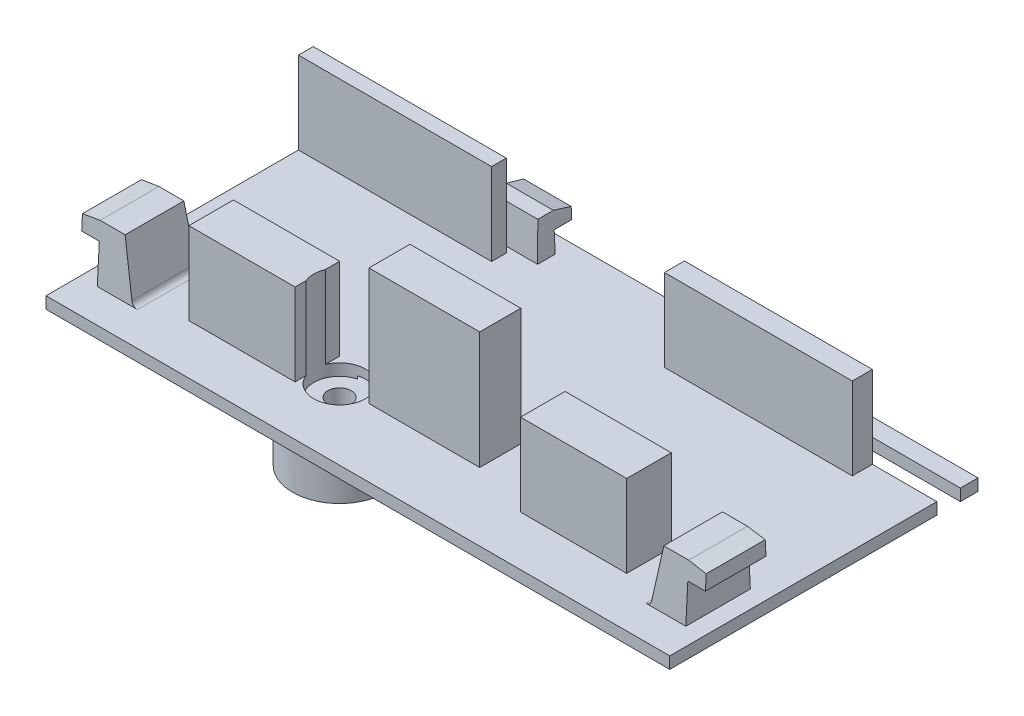
from build123d import *

# Parameters (mm, degrees)
SKETCH1_W                        = 53.116817528
SKETCH1_H                        = 26.25
MAIN_BODY_DEPTH                  = 1
SNAP_START                       = 162.404443258
SNAP_HOOK_RIGHT_DEPTH            = 2.123076923
SNAP_START_2                     = 4.123794828
SNAP_HOOK_RIGHT_2_DEPTH          = 5.157223338
SNAP_START_3                     = 3.953469545
SNAP_HOOK_RIGHT_3_DEPTH          = 5.497873903
SNAP_START_4                     = 160
SNAP_HOOK_RIGHT_4_DEPTH          = 6
SNAP_START_5                     = 210.398183863
SNAP_HOOK_LEFT_DEPTH             = 2.123076923
SNAP_HOOK_LEFT_2_DEPTH           = 5.157223338
SNAP_HOOK_LEFT_3_DEPTH           = 5.497873903
SNAP_START_6                     = 209
SNAP_HOOK_LEFT_4_DEPTH           = 6
SOLAR_ARM_HOLES_REACH            = 216.551
SKETCH6_W                        = 11
SKETCH6_H                        = 2
SKETCH9_W                        = 9.436817528
SKETCH9_H                        = 3.49554206
BOSS_EXTRUDE1_DEPTH              = 10
SKETCH5_W                        = 0.807692308
SKETCH5_H                        = 3.288461538
SKETCH5_H_2                      = 4.615384615
VERSION_2_DEPTH                  = 0.25
FILLET1_R                        = 0.5
SKETCH12_W                       = 16
SKETCH12_H                       = 1.70445794
SERVO_2_SPACER_BOTTOM_BACK_DEPTH = 7
SKETCH13_W                       = 16.45
SKETCH13_H                       = 1.25445794
BOSS_EXTRUDE2_DEPTH              = 7
SKETCH10_W                       = 9.044307921
SKETCH10_H                       = 3.79554206
SERVO_SPACERS_BACK_DEPTH         = 7
SNAP_START_7                     = -12.431072473
SNAP_HOOK3_DEPTH                 = 1.5
SNAP_START_8                     = -13.931072473
SNAP_HOOK3_2_DEPTH               = 1.5
SNAP_START_9                     = 194
SNAP_HOOK3_3_DEPTH               = 7
SNAP_HOOK5_DEPTH                 = 1.5
SNAP_HOOK5_2_DEPTH               = 1.5
SNAP_START_10                    = 174
SNAP_HOOK5_3_DEPTH               = 7
SKETCH14_R                       = 2.2
CUT_EXTRUDE1_DEPTH               = 215.756082322
SKETCH15_R                       = 4
SKETCH15_R_2                     = 1
BOSS_EXTRUDE3_DEPTH              = 5


with BuildPart() as part:
    # Sketch1 → Main Body (new body)
    with BuildSketch(Plane(origin=(0, 0, 0), x_dir=(1, 0, 0), z_dir=(0, 1, 0))):
        with Locations((187.462852022, 0.806072473)):
            Rectangle(SKETCH1_W, SKETCH1_H)
    extrude(amount=MAIN_BODY_DEPTH)



with BuildPart() as body_2:
    # Snap Hook - Right: read off the stored shape, not the designer's step
    # Snap Hook - Right outline → Snap Hook - Right (new body)
    with BuildSketch(Plane.YZ.offset(SNAP_START)):
        Polygon((5.75, 4.202406497), (5.75, 9.202406497), (4.25, 9.281018166), (4.25, 4.123794828), align=None)
    extrude(amount=SNAP_HOOK_RIGHT_DEPTH)


with BuildPart() as part_1:
    add(part.part)

    add(body_2.part)  # Snap Hook - Right 2 merges body 2
    # Snap Hook - Right 2 outline → Snap Hook - Right 2 (add)
    with BuildSketch(Plane.XY.offset(SNAP_START_2)):
        Polygon((164.527520181, 4.25), (162.404443258, 4.25), (162.404443258, 1), (165.404443258, 1), (164.527520181, 5.75), align=None)
        Polygon((160.904443258, 5.5), (160.904443258, 4.25), (162.404443258, 4.25), (162.404443258, 5.75), align=None)
    extrude(amount=SNAP_HOOK_RIGHT_2_DEPTH)

    # Snap Hook - Right 3 outline → Snap Hook - Right 3 (add)
    with BuildSketch(Plane.XY.offset(SNAP_START_3)):
        Polygon((164.527520181, 4.25), (162.404443258, 4.25), (162.404443258, 1), (165.404443258, 1), (164.527520181, 5.75), align=None)
    extrude(amount=SNAP_HOOK_RIGHT_3_DEPTH)

    # Snap Hook - Right 4 outline → Snap Hook - Right 4 (cut)
    with BuildSketch(Plane.YZ.offset(SNAP_START_4)):
        Polygon((5.75, 9.202406497), (7, 9.136896773), (7, 9.451343448), (1, 9.451343448), align=None)
        Polygon((7, 4.267916221), (5.75, 4.202406497), (1, 3.953469545), (7, 3.953469545), align=None)
    extrude(amount=SNAP_HOOK_RIGHT_4_DEPTH, mode=Mode.SUBTRACT)



with BuildPart() as body_2_2:
    # Snap Hook - Left: read off the stored shape, not the designer's step
    # Snap Hook - Left outline → Snap Hook - Left (new body)
    with BuildSketch(Plane.YZ.offset(SNAP_START_5)):
        Polygon((5.75, 4.202406497), (5.75, 9.202406497), (4.25, 9.281018166), (4.25, 4.123794828), align=None)
    extrude(amount=SNAP_HOOK_LEFT_DEPTH)


with BuildPart() as part_2:
    add(part_1.part)

    add(body_2_2.part)  # Snap Hook - Left 2 merges body 2 2
    # Snap Hook - Left 2 outline → Snap Hook - Left 2 (add)
    with BuildSketch(Plane.XY.offset(SNAP_START_2)):
        Polygon((212.521260786, 1), (212.521260786, 4.25), (210.398183863, 4.25), (210.398183863, 5.75), (209.521260786, 1), align=None)
        Polygon((214.021260786, 4.25), (214.021260786, 5.5), (212.521260786, 5.75), (212.521260786, 4.25), align=None)
    extrude(amount=SNAP_HOOK_LEFT_2_DEPTH)

    # Snap Hook - Left 3 outline → Snap Hook - Left 3 (add)
    with BuildSketch(Plane.XY.offset(SNAP_START_3)):
        Polygon((212.521260786, 1), (212.521260786, 4.25), (210.398183863, 4.25), (210.398183863, 5.75), (209.521260786, 1), align=None)
    extrude(amount=SNAP_HOOK_LEFT_3_DEPTH)

    # Snap Hook - Left 4 outline → Snap Hook - Left 4 (cut)
    with BuildSketch(Plane.YZ.offset(SNAP_START_6)):
        Polygon((5.75, 9.202406497), (7, 9.136896773), (7, 9.451343448), (1, 9.451343448), align=None)
        Polygon((7, 4.267916221), (5.75, 4.202406497), (1, 3.953469545), (7, 3.953469545), align=None)
    extrude(amount=SNAP_HOOK_LEFT_4_DEPTH, mode=Mode.SUBTRACT)

    # Sketch6 → Solar Arm holes (cut, up to next)
    with BuildSketch(Plane.XZ, mode=Mode.PRIVATE) as solar_arm_holes_sk1:
        with Locations((166.404443258, -11.431072473)):
            Rectangle(SKETCH6_W, SKETCH6_H)
    solar_arm_holes_tool1 = extrude(solar_arm_holes_sk1.sketch, amount=-SOLAR_ARM_HOLES_REACH, mode=Mode.PRIVATE) & part_2.part
    # Sketch6 → Solar Arm holes (cut, up to next)
    with BuildSketch(Plane.XZ, mode=Mode.PRIVATE) as solar_arm_holes_sk2:
        with Locations((208.521260786, -11.431072473)):
            Rectangle(SKETCH6_W, SKETCH6_H)
    solar_arm_holes_tool2 = extrude(solar_arm_holes_sk2.sketch, amount=-SOLAR_ARM_HOLES_REACH, mode=Mode.PRIVATE) & part_2.part
    add(solar_arm_holes_tool1.solids().sort_by_distance((166.404443, 0, -11.431072))[0], mode=Mode.SUBTRACT)
    add(solar_arm_holes_tool2.solids().sort_by_distance((208.521261, 0, -11.431072))[0], mode=Mode.SUBTRACT)

    # Sketch9 → Boss-Extrude1 (add)
    with BuildSketch(Plane(origin=(0, 1, 0), x_dir=(1, 0, 0), z_dir=(0, 1, 0))):
        with Locations((187.322852022, -4.771156497)):
            Rectangle(SKETCH9_W, SKETCH9_H)
    extrude(amount=BOSS_EXTRUDE1_DEPTH)

    # Sketch5 → Version 2 (cut)
    # profile 1 of 14: a face of its own
    with BuildSketch(Plane.XZ):
        with BuildLine():
            Line((168.666698176, 4.842665507), (168.06273183, 4.290081373))
            add(Edge.make_bspline(
                [(168.06273183, 4.290081373), (168.036860501, 4.326575571), (167.987191158, 4.396639343), (167.906682334, 4.490456385), (167.826537048, 4.570489303), (167.746012804, 4.636403758), (167.664395865, 4.687799269), (167.581827906, 4.724187859), (167.498777028, 4.747320431), (167.442979658, 4.750200992), (167.415496253, 4.751619834)],
                knots=[0, 0, 0, 0, 1.299362458, 2.494594718, 3.587462134, 4.587049575, 5.512617175, 6.380583204, 7.202344345, 8, 8, 8, 8], degree=3))
            add(Edge.make_bspline(
                [(167.415496253, 4.751619834), (167.389860521, 4.750720791), (167.340364658, 4.748984974), (167.269804633, 4.731731089), (167.207160438, 4.701953416), (167.152493211, 4.663016603), (167.109188702, 4.616106771), (167.07461341, 4.566910419), (167.055144615, 4.512608772), (167.052582138, 4.47531221), (167.05131356, 4.4568482)],
                knots=[0, 0, 0, 0, 1.185010067, 2.2879431, 3.333075148, 4.379039566, 5.372662701, 6.27520591, 7.14612461, 8, 8, 8, 8], degree=3))
            add(Edge.make_bspline(
                [(167.05131356, 4.4568482), (167.052108514, 4.43811793), (167.053709439, 4.40039777), (167.069172203, 4.345114177), (167.092479003, 4.291095672), (167.114749602, 4.258212037), (167.126133272, 4.241403488)],
                knots=[0, 0, 0, 0, 0.967525499, 1.948461899, 2.951351359, 4, 4, 4, 4], degree=3))
            add(Edge.make_bspline(
                [(167.126133272, 4.241403488), (167.136482259, 4.228338379), (167.160304262, 4.198264223), (167.205727943, 4.150631447), (167.262770545, 4.092277128), (167.33362719, 4.025207899), (167.415356422, 3.947011689), (167.511746498, 3.860762419), (167.620022889, 3.763789052), (167.69698324, 3.69626031), (167.737311156, 3.660874642)],
                knots=[0, 0, 0, 0, 0.473873513, 1.090794244, 1.870441696, 2.795289791, 3.865433203, 5.087734844, 6.473946851, 8, 8, 8, 8], degree=3))
            add(Edge.make_bspline(
                [(167.737311156, 3.660874642), (167.775164707, 3.628114303), (167.847002882, 3.565941987), (167.949214339, 3.477698365), (168.039041186, 3.398307731), (168.117791996, 3.328961567), (168.184272984, 3.268932274), (168.238763635, 3.217932911), (168.28192946, 3.176956344), (168.306466705, 3.152206472), (168.31693856, 3.141643873)],
                knots=[0, 0, 0, 0, 1.543621617, 2.929473131, 4.163658386, 5.240097082, 6.164993805, 6.925417477, 7.541396219, 8, 8, 8, 8], degree=3))
            add(Edge.make_bspline(
                [(168.31693856, 3.141643873), (168.356666597, 3.098649628), (168.433037837, 3.015999591), (168.532293525, 2.887918026), (168.613984168, 2.762884302), (168.677181597, 2.638545707), (168.724910838, 2.513108283), (168.758560585, 2.383495683), (168.778713643, 2.248353537), (168.780951103, 2.15613552), (168.782082791, 2.10949243)],
                knots=[0, 0, 0, 0, 1.206664779, 2.319633467, 3.337109185, 4.282041471, 5.190008762, 6.099243693, 7.03861361, 8, 8, 8, 8], degree=3))
            add(Edge.make_bspline(
                [(168.782082791, 2.10949243), (168.781277284, 2.06404446), (168.77969685, 1.97487385), (168.760339563, 1.844385946), (168.732737208, 1.719503358), (168.690059125, 1.601584986), (168.63804333, 1.488695236), (168.572834018, 1.38259257), (168.496254623, 1.282203187), (168.408482878, 1.18932167), (168.311396905, 1.105038131), (168.207262973, 1.030006934), (168.095062807, 0.968059123), (167.975755027, 0.91704952), (167.849403497, 0.877761242), (167.716158739, 0.848723542), (167.575816946, 0.831295573), (167.479849205, 0.829473685), (167.430820772, 0.828542911)],
                knots=[0, 0, 0, 0, 1.043214005, 2.046824704, 3.02475056, 3.976699089, 4.921714032, 5.875962561, 6.831408892, 7.817874052, 8.806269674, 9.781291748, 10.760897367, 11.74438705, 12.757449933, 13.795994037, 14.874007457, 16, 16, 16, 16], degree=3))
            add(Edge.make_bspline(
                [(167.430820772, 0.828542911), (167.392333869, 0.829225694), (167.316107729, 0.830577997), (167.203761923, 0.841618421), (167.095279347, 0.859436491), (166.990782197, 0.884975109), (166.889799696, 0.917336001), (166.792327695, 0.956863591), (166.699039077, 1.004170541), (166.609227976, 1.058284033), (166.523330984, 1.121116926), (166.440261968, 1.191384621), (166.360846047, 1.270167867), (166.284701805, 1.357280344), (166.212316431, 1.452968735), (166.141320495, 1.555900401), (166.074869268, 1.667985614), (166.033819389, 1.746614298), (166.012852022, 1.786776084)],
                knots=[0, 0, 0, 0, 1.016823716, 2.013894106, 2.979844003, 3.91962641, 4.853723003, 5.779685073, 6.695824784, 7.614987388, 8.547259901, 9.504950863, 10.487499108, 11.500346958, 12.559593716, 13.656357062, 14.802919212, 16, 16, 16, 16], degree=3))
            Line((166.012852022, 1.786776084), (166.72318856, 2.213158296))
            add(Edge.make_bspline(
                [(166.72318856, 2.213158296), (166.749415603, 2.167569421), (166.799695084, 2.080171651), (166.884898366, 1.962741671), (166.972184778, 1.862182331), (167.063572305, 1.780271025), (167.157949708, 1.715912492), (167.255772852, 1.669917419), (167.357110466, 1.641446521), (167.426137044, 1.637969567), (167.460568368, 1.636235219)],
                knots=[0, 0, 0, 0, 1.283663364, 2.460892379, 3.537111102, 4.529833553, 5.449777664, 6.316464042, 7.160231139, 8, 8, 8, 8], degree=3))
            add(Edge.make_bspline(
                [(167.460568368, 1.636235219), (167.495589953, 1.637651582), (167.56353693, 1.640399532), (167.660522544, 1.665781521), (167.749442627, 1.705633106), (167.82630449, 1.762495823), (167.89138627, 1.82812404), (167.939420359, 1.901138432), (167.969595698, 1.980138243), (167.972785963, 2.035016707), (167.974390483, 2.06261743)],
                knots=[0, 0, 0, 0, 1.13588714, 2.203786484, 3.234766741, 4.283437687, 5.291419208, 6.222934724, 7.106237994, 8, 8, 8, 8], degree=3))
            add(Edge.make_bspline(
                [(167.974390483, 2.06261743), (167.972908774, 2.088295412), (167.969898825, 2.140457773), (167.947728461, 2.218014816), (167.913069421, 2.295536587), (167.872065333, 2.359122041), (167.830338539, 2.412360419), (167.790438312, 2.458489064), (167.74185039, 2.509453142), (167.684697972, 2.565316761), (167.619736189, 2.626571703), (167.54691032, 2.693211969), (167.465386431, 2.764650538), (167.407765185, 2.813313785), (167.377635676, 2.838759257)],
                knots=[0, 0, 0, 0, 0.916159276, 1.861089862, 2.860218735, 3.940849679, 4.552606315, 5.27541173, 6.11797699, 7.06649574, 8.129236253, 9.306560635, 10.591630461, 12, 12, 12, 12], degree=3))
            add(Edge.make_bspline(
                [(167.377635676, 2.838759257), (167.320358279, 2.887221427), (167.210425618, 2.980235), (167.05507682, 3.117613119), (166.915093644, 3.24600556), (166.791685134, 3.366999532), (166.683278875, 3.478360558), (166.590609041, 3.580993156), (166.514693653, 3.675688994), (166.434809076, 3.787849877), (166.358902756, 3.924525621), (166.293298155, 4.088962384), (166.250736659, 4.253378283), (166.245968236, 4.363758061), (166.243621253, 4.41808618)],
                knots=[0, 0, 0, 0, 1.345494975, 2.582412109, 3.71882943, 4.751509156, 5.681369928, 6.505683931, 7.230279997, 7.856715994, 8.973648664, 10.023341002, 11.027102913, 12, 12, 12, 12], degree=3))
            add(Edge.make_bspline(
                [(166.243621253, 4.41808618), (166.24459736, 4.456612766), (166.246520396, 4.532514279), (166.263674174, 4.644116394), (166.289311149, 4.751803058), (166.326543396, 4.855181381), (166.374866358, 4.954121877), (166.433552717, 5.049108902), (166.503513764, 5.139268216), (166.582355139, 5.224540051), (166.66921815, 5.302468804), (166.762042315, 5.371248737), (166.860302243, 5.429341268), (166.963396828, 5.477533241), (167.071964904, 5.514421135), (167.185206656, 5.540569113), (167.303284509, 5.556121096), (167.383598515, 5.558235208), (167.424510676, 5.559312142)],
                knots=[0, 0, 0, 0, 1.010766082, 1.991317756, 2.957454644, 3.913069143, 4.869106762, 5.843196583, 6.838735724, 7.860187025, 8.887984031, 9.89767229, 10.887916223, 11.879572884, 12.879850636, 13.892031539, 14.926195476, 16, 16, 16, 16], degree=3))
            add(Edge.make_bspline(
                [(167.424510676, 5.559312142), (167.47753081, 5.557372552), (167.583152558, 5.553508684), (167.739317357, 5.523294494), (167.891852604, 5.475779499), (168.014768365, 5.418457885), (168.112570141, 5.362930409), (168.187526067, 5.311807705), (168.263797756, 5.2532439), (168.342000292, 5.187054443), (168.420680551, 5.111992239), (168.50207579, 5.029844202), (168.585076897, 4.939900382), (168.639014457, 4.875644933), (168.666698176, 4.842665507)],
                knots=[0, 0, 0, 0, 1.282922637, 2.555718331, 3.837320111, 5.142675274, 5.830281639, 6.55870424, 7.337177975, 8.157850921, 9.037902056, 9.96903443, 10.957596896, 12, 12, 12, 12], degree=3))
        make_face()
    # profile 2 of 14: a face of its own
    with BuildSketch(Plane.XZ):
        with BuildLine():
            Line((170.997467406, 4.232389065), (171.805159714, 4.232389065))
            Line((171.805159714, 4.232389065), (171.805159714, 3.839360219))
            add(Edge.make_bspline(
                [(171.805159714, 3.839360219), (171.841085458, 3.875619618), (171.911820294, 3.947011395), (172.029041754, 4.038791942), (172.151315607, 4.117275649), (172.280123618, 4.180813149), (172.415150727, 4.22932862), (172.555756977, 4.264880041), (172.702664579, 4.285854266), (172.802688801, 4.288656718), (172.853537118, 4.290081373)],
                knots=[0, 0, 0, 0, 1.041528618, 2.050684245, 3.032913108, 4.004406485, 4.976926473, 5.95771665, 6.961784757, 8, 8, 8, 8], degree=3))
            add(Edge.make_bspline(
                [(172.853537118, 4.290081373), (172.904452573, 4.288479855), (173.004677999, 4.285327319), (173.150906198, 4.25647866), (173.289434053, 4.209609338), (173.418737433, 4.142802879), (173.539750866, 4.060300374), (173.647113378, 3.957839484), (173.743752541, 3.839498955), (173.795264935, 3.750032243), (173.821686156, 3.704143873)],
                knots=[0, 0, 0, 0, 1.023965777, 2.015643508, 2.987309376, 3.958410333, 4.93654923, 5.924956801, 6.93568961, 8, 8, 8, 8], degree=3))
            add(Edge.make_bspline(
                [(173.821686156, 3.704143873), (173.855720104, 3.750157077), (173.922519192, 3.840468085), (174.040926661, 3.958379345), (174.168960461, 4.060311058), (174.309097753, 4.14341197), (174.457616975, 4.209381306), (174.613868226, 4.256304515), (174.77643488, 4.285279105), (174.887070409, 4.288467318), (174.943080387, 4.290081373)],
                knots=[0, 0, 0, 0, 1.041189987, 2.043563759, 3.033412161, 4.015238574, 5.00275396, 5.986226558, 6.980513695, 8, 8, 8, 8], degree=3))
            add(Edge.make_bspline(
                [(174.943080387, 4.290081373), (175.000932044, 4.288405426), (175.113592766, 4.285141676), (175.276854332, 4.253032087), (175.429768544, 4.203417954), (175.568956042, 4.131217248), (175.694813802, 4.045692652), (175.802059796, 3.944641773), (175.891064171, 3.831590708), (175.949017434, 3.726028598), (175.986482661, 3.632699604), (176.009104497, 3.551485892), (176.030262914, 3.460800511), (176.045463119, 3.359424522), (176.05965184, 3.248310781), (176.06788895, 3.126720565), (176.073487799, 2.995063485), (176.074082468, 2.903970668), (176.074390483, 2.856788103)],
                knots=[0, 0, 0, 0, 1.321991808, 2.574456155, 3.791773975, 4.987670122, 6.148905103, 7.262530793, 8.344737981, 9.427709016, 10.004683293, 10.642050061, 11.354108788, 12.133887687, 12.985666279, 13.916212488, 14.92067847, 16, 16, 16, 16], degree=3))
            Line((176.074390483, 2.856788103), (176.074390483, 0.943927527))
            Line((176.074390483, 0.943927527), (175.266698176, 0.943927527))
            Line((175.266698176, 0.943927527), (175.266698176, 2.595369834))
            add(Edge.make_bspline(
                [(175.266698176, 2.595369834), (175.266025925, 2.639542846), (175.2647356, 2.724328951), (175.259249932, 2.845938431), (175.246970661, 2.956227735), (175.232577782, 3.055807763), (175.211981294, 3.14415053), (175.186867617, 3.221468997), (175.157735905, 3.287874461), (175.122560239, 3.343360001), (175.083163453, 3.390087591), (175.039340212, 3.430142388), (174.99154744, 3.464317057), (174.939351825, 3.493446106), (174.881385977, 3.513146658), (174.81960673, 3.528604414), (174.753530644, 3.539131257), (174.707845653, 3.539758836), (174.684366445, 3.540081373)],
                knots=[0, 0, 0, 0, 1.669139205, 3.203761885, 4.596586177, 5.860166715, 7.002923539, 8.018877315, 8.928339525, 9.734594377, 10.491888885, 11.231098709, 11.971440889, 12.708030942, 13.480072485, 14.275788656, 15.113863979, 16, 16, 16, 16], degree=3))
            add(Edge.make_bspline(
                [(174.684366445, 3.540081373), (174.648185318, 3.538830497), (174.577187057, 3.536375903), (174.47372812, 3.51291951), (174.376372499, 3.474570817), (174.285484926, 3.422400818), (174.203021101, 3.357241473), (174.130886129, 3.279956278), (174.071312702, 3.190099831), (174.030074524, 3.106731073), (174.004305843, 3.031348963), (173.98612838, 2.96679024), (173.97195977, 2.893783873), (173.960869898, 2.813069248), (173.950230459, 2.724190077), (173.945010811, 2.627258752), (173.939669517, 2.522409932), (173.93973905, 2.449945909), (173.939775099, 2.412377046)],
                knots=[0, 0, 0, 0, 1.129913425, 2.217230253, 3.297175357, 4.391411011, 5.481605898, 6.571841268, 7.681894157, 8.841607612, 9.468549532, 10.170608623, 10.93710061, 11.791434153, 12.717934886, 13.734733707, 14.825576123, 16, 16, 16, 16], degree=3))
            Line((173.939775099, 2.412377046), (173.939775099, 0.943927527))
            Line((173.939775099, 0.943927527), (173.132082791, 0.943927527))
            Line((173.132082791, 0.943927527), (173.132082791, 2.520550123))
            add(Edge.make_bspline(
                [(173.132082791, 2.520550123), (173.132014977, 2.555710882), (173.131884525, 2.623348795), (173.127963388, 2.721019235), (173.122771038, 2.811204492), (173.115491967, 2.89415611), (173.107096992, 2.969770915), (173.094981109, 3.037635244), (173.082252256, 3.098123048), (173.060428465, 3.166835389), (173.029675937, 3.242980162), (172.983731211, 3.323727453), (172.928177762, 3.39133428), (172.864419701, 3.446326768), (172.792370355, 3.488226631), (172.71385496, 3.519394922), (172.627374313, 3.536218608), (172.567846818, 3.538766613), (172.537130868, 3.540081373)],
                knots=[0, 0, 0, 0, 1.256487322, 2.417074606, 3.49288742, 4.484586665, 5.393016842, 6.210437544, 6.947749329, 7.599905853, 8.784490193, 9.876739139, 10.906602197, 11.896672079, 12.869113195, 13.872201355, 14.902064413, 16, 16, 16, 16], degree=3))
            add(Edge.make_bspline(
                [(172.537130868, 3.540081373), (172.502424488, 3.538903378), (172.433688212, 3.53657035), (172.333563326, 3.511511718), (172.237834649, 3.473866652), (172.148608116, 3.420241552), (172.067386613, 3.35354881), (171.995973866, 3.274065303), (171.93671352, 3.181885311), (171.895292294, 3.096216943), (171.86989935, 3.018954154), (171.851233122, 2.952719102), (171.837591675, 2.878104971), (171.826209994, 2.795949544), (171.815633545, 2.706155846), (171.810392299, 2.608328999), (171.805056284, 2.502577436), (171.805124406, 2.429513045), (171.805159714, 2.391643873)],
                knots=[0, 0, 0, 0, 1.07893236, 2.136834559, 3.195274846, 4.273923004, 5.364443877, 6.458052972, 7.587287137, 8.767908, 9.410170275, 10.118584836, 10.909717261, 11.770069756, 12.702352573, 13.724628867, 14.820678298, 16, 16, 16, 16], degree=3))
            Line((171.805159714, 2.391643873), (171.805159714, 0.943927527))
            Line((171.805159714, 0.943927527), (170.997467406, 0.943927527))
            Line((170.997467406, 0.943927527), (170.997467406, 4.232389065))
        make_face()
    # profile 3 of 14: a face of its own
    with BuildSketch(Plane.XZ):
        with BuildLine():
            Line((180.885928945, 4.232389065), (181.693621253, 4.232389065))
            Line((181.693621253, 4.232389065), (181.693621253, 0.943927527))
            Line((181.693621253, 0.943927527), (180.885928945, 0.943927527))
            Line((180.885928945, 0.943927527), (180.885928945, 1.302701565))
            add(Edge.make_bspline(
                [(180.885928945, 1.302701565), (180.845908089, 1.267778883), (180.76823551, 1.200000854), (180.645848659, 1.112057138), (180.52310418, 1.039514939), (180.399412282, 0.981739033), (180.272871872, 0.939077473), (180.14257191, 0.908189507), (180.006635938, 0.889974118), (179.914228537, 0.887494501), (179.867299137, 0.886235219)],
                knots=[0, 0, 0, 0, 1.129196829, 2.191548051, 3.199897424, 4.157751732, 5.089409408, 6.034969131, 7.002052659, 8, 8, 8, 8], degree=3))
            add(Edge.make_bspline(
                [(179.867299137, 0.886235219), (179.814618799, 0.887420362), (179.710519466, 0.889762271), (179.557765251, 0.914414646), (179.410265871, 0.952150601), (179.268141053, 1.005551693), (179.13164938, 1.07474904), (178.999746278, 1.157937186), (178.874692968, 1.258036533), (178.755448423, 1.370716036), (178.646268833, 1.494664291), (178.550823005, 1.628160914), (178.470369266, 1.769312549), (178.404457822, 1.917651213), (178.35260996, 2.073068035), (178.315649853, 2.23605595), (178.293843348, 2.406673168), (178.291144317, 2.522890935), (178.289775099, 2.5818482)],
                knots=[0, 0, 0, 0, 0.980476535, 1.937477201, 2.874147792, 3.812856188, 4.758993464, 5.720109578, 6.712210464, 7.737600662, 8.772720504, 9.783789959, 10.789002326, 11.793715968, 12.802552247, 13.835794126, 14.902098527, 16, 16, 16, 16], degree=3))
            add(Edge.make_bspline(
                [(178.289775099, 2.5818482), (178.291212098, 2.642898524), (178.294030933, 2.762655539), (178.314650541, 2.938393263), (178.350928595, 3.10542245), (178.400396329, 3.263974458), (178.464027979, 3.414076679), (178.541527077, 3.555975029), (178.633947925, 3.689298609), (178.740446569, 3.811778156), (178.855438948, 3.924036578), (178.978460464, 4.021766436), (179.10758733, 4.104792498), (179.242956766, 4.172573984), (179.38454944, 4.224952086), (179.531806348, 4.263244756), (179.685381206, 4.286221703), (179.789997643, 4.288784131), (179.842960195, 4.290081373)],
                knots=[0, 0, 0, 0, 1.136281865, 2.228943489, 3.287578264, 4.313574083, 5.316051562, 6.317280042, 7.318008486, 8.329309503, 9.333984563, 10.305318864, 11.248632312, 12.186624717, 13.117503092, 14.05354244, 15.014596925, 16, 16, 16, 16], degree=3))
            add(Edge.make_bspline(
                [(179.842960195, 4.290081373), (179.892020679, 4.289062131), (179.989093692, 4.287045419), (180.131777036, 4.265147784), (180.2701593, 4.232029166), (180.403485603, 4.184841098), (180.53284953, 4.125256561), (180.656025942, 4.050592695), (180.775709432, 3.96398759), (180.848735179, 3.896347167), (180.885928945, 3.861896277)],
                knots=[0, 0, 0, 0, 1.017011718, 2.012299608, 2.98747302, 3.965332399, 4.941441765, 5.936729654, 6.94912688, 8, 8, 8, 8], degree=3))
            Line((180.885928945, 3.861896277), (180.885928945, 4.232389065))
        make_face()
        with BuildLine():
            add(Edge.make_bspline(
                [(180.012431349, 3.540081373), (179.980247191, 3.539093852), (179.917168344, 3.537158375), (179.824402266, 3.525516347), (179.735745725, 3.505002575), (179.651831011, 3.474697883), (179.571407488, 3.437782352), (179.495696398, 3.391546257), (179.424072875, 3.336896175), (179.356958145, 3.275155184), (179.29577318, 3.207290547), (179.243028169, 3.133235523), (179.198203431, 3.054985476), (179.160293353, 2.972305135), (179.133158338, 2.884216134), (179.111667417, 2.791865237), (179.10051502, 2.694497984), (179.098493442, 2.628145215), (179.097467406, 2.594468392)],
                knots=[0, 0, 0, 0, 1.04836806, 2.054732945, 3.03993516, 4.00574415, 4.955904794, 5.917688631, 6.888591924, 7.88601754, 8.884115178, 9.859153345, 10.841239365, 11.818093293, 12.814750328, 13.83810466, 14.90274714, 16, 16, 16, 16], degree=3))
            add(Edge.make_bspline(
                [(179.097467406, 2.594468392), (179.098477769, 2.560486101), (179.100468678, 2.49352439), (179.11184774, 2.39533581), (179.132565329, 2.301635883), (179.16279151, 2.213182111), (179.199704688, 2.128780959), (179.244636326, 2.048821946), (179.299826975, 1.974718849), (179.361065575, 1.904718139), (179.429557153, 1.842210221), (179.501585951, 1.786708929), (179.578135824, 1.740271034), (179.658376261, 1.702739633), (179.74203717, 1.672154696), (179.830167403, 1.65189874), (179.921903614, 1.638949491), (179.984442612, 1.637146224), (180.016037118, 1.636235219)],
                knots=[0, 0, 0, 0, 1.099136573, 2.165835871, 3.191374663, 4.196217796, 5.183857741, 6.167377911, 7.154730987, 8.166690795, 9.170734848, 10.148332609, 11.103258353, 12.059567475, 13.009337315, 13.978056681, 14.978520572, 16, 16, 16, 16], degree=3))
            add(Edge.make_bspline(
                [(180.016037118, 1.636235219), (180.048820743, 1.637228276), (180.11309447, 1.639175208), (180.207373979, 1.65071099), (180.297221496, 1.671299977), (180.382263206, 1.701778171), (180.463798041, 1.738428722), (180.541090223, 1.783761328), (180.613301015, 1.838286003), (180.68079613, 1.900585134), (180.742642392, 1.969003927), (180.796116825, 2.044030064), (180.842695012, 2.123264004), (180.879326613, 2.208579125), (180.908417242, 2.298482812), (180.929289097, 2.393533025), (180.940642175, 2.493832241), (180.942615672, 2.562290364), (180.943621253, 2.597172719)],
                knots=[0, 0, 0, 0, 1.050008698, 2.058587853, 3.036635738, 3.995319155, 4.947022481, 5.895997462, 6.858296291, 7.838991643, 8.833936038, 9.806048392, 10.784806122, 11.771666913, 12.772873988, 13.80724452, 14.882696879, 16, 16, 16, 16], degree=3))
            add(Edge.make_bspline(
                [(180.943621253, 2.597172719), (180.942628167, 2.631455114), (180.940688382, 2.698418589), (180.929240134, 2.796623605), (180.908220101, 2.889807466), (180.879728205, 2.978141457), (180.842444917, 3.061423603), (180.795831487, 3.138730504), (180.742943638, 3.212740554), (180.680412649, 3.279310977), (180.613283169, 3.341159015), (180.540010401, 3.394034823), (180.462902834, 3.439604663), (180.381486718, 3.477019259), (180.295008176, 3.504445576), (180.205007116, 3.525680769), (180.110079335, 3.537151387), (180.045511845, 3.539088773), (180.012431349, 3.540081373)],
                knots=[0, 0, 0, 0, 1.106611376, 2.161533483, 3.185006901, 4.184773755, 5.152708835, 6.122342771, 7.094156588, 8.082475533, 9.064254463, 10.03606828, 10.992420271, 11.951521816, 12.920622147, 13.915721683, 14.932141191, 16, 16, 16, 16], degree=3))
        make_face(mode=Mode.SUBTRACT)
    # profile 4 of 14: a face of its own
    with BuildSketch(Plane.XZ):
        with BuildLine():
            Line((183.909005868, 4.232389065), (184.60131356, 4.232389065))
            Line((184.60131356, 4.232389065), (184.60131356, 3.827641469))
            add(Edge.make_bspline(
                [(184.60131356, 3.827641469), (184.620897616, 3.863611499), (184.659175465, 3.933916415), (184.729495084, 4.028286843), (184.81028111, 4.107762984), (184.898630653, 4.174007154), (184.994811481, 4.225637981), (185.096248043, 4.262431453), (185.202072553, 4.286342112), (185.274262445, 4.288825978), (185.310748656, 4.290081373)],
                knots=[0, 0, 0, 0, 1.09866127, 2.147379032, 3.14564304, 4.131443017, 5.102343063, 6.064490016, 7.021754664, 8, 8, 8, 8], degree=3))
            add(Edge.make_bspline(
                [(185.310748656, 4.290081373), (185.337242198, 4.28884078), (185.39119251, 4.286314491), (185.473420377, 4.271629131), (185.556834648, 4.245075209), (185.611728426, 4.221166932), (185.639775099, 4.208951565)],
                knots=[0, 0, 0, 0, 0.931404136, 1.896671404, 2.925354185, 4, 4, 4, 4], degree=3))
            Line((185.639775099, 4.208951565), (185.389174137, 3.524756853))
            add(Edge.make_bspline(
                [(185.389174137, 3.524756853), (185.36677399, 3.535579522), (185.324670336, 3.555921972), (185.263543141, 3.579928158), (185.208067677, 3.59457556), (185.172897251, 3.596761081), (185.156602022, 3.59777368)],
                knots=[0, 0, 0, 0, 1.214386998, 2.282580073, 3.20428172, 4, 4, 4, 4], degree=3))
            add(Edge.make_bspline(
                [(185.156602022, 3.59777368), (185.141216157, 3.597102678), (185.110949509, 3.595782702), (185.066276785, 3.584470951), (185.024204381, 3.564964187), (184.98270483, 3.539974087), (184.945051988, 3.505235978), (184.907422403, 3.465020449), (184.874261198, 3.41536903), (184.83926651, 3.360104479), (184.809469784, 3.292460718), (184.783920009, 3.211708007), (184.761154954, 3.116911982), (184.745489489, 3.007569323), (184.730348187, 2.884738107), (184.721335713, 2.74751677), (184.714618601, 2.596339218), (184.714207895, 2.490811831), (184.713993849, 2.435814546)],
                knots=[0, 0, 0, 0, 0.544232178, 1.070598461, 1.618251235, 2.182094276, 2.777567932, 3.425210017, 4.127676488, 4.886675562, 5.738955394, 6.734782583, 7.883056018, 9.186093582, 10.642914445, 12.264202625, 14.053029461, 16, 16, 16, 16], degree=3))
            Line((184.713993849, 2.435814546), (184.716698176, 2.275357815))
            Line((184.716698176, 2.275357815), (184.716698176, 0.943927527))
            Line((184.716698176, 0.943927527), (183.909005868, 0.943927527))
            Line((183.909005868, 0.943927527), (183.909005868, 4.232389065))
        make_face()
    # profile 5 of 14: a face of its own
    with BuildSketch(Plane.XZ):
        Polygon((187.624390483, 5.559312142), (188.432082791, 5.559312142), (188.432082791, 4.232389065), (188.95131356, 4.232389065), (188.95131356, 3.540081373), (188.432082791, 3.540081373), (188.432082791, 0.943927527), (187.624390483, 0.943927527), (187.624390483, 3.540081373), (187.22054433, 3.540081373), (187.22054433, 4.232389065), (187.624390483, 4.232389065), align=None)
    # profile 6 of 14: a face of its own
    with BuildSketch(Plane.XZ):
        with BuildLine():
            add(Edge.make_bspline(
                [(191.280279906, 5.61700445), (191.315091439, 5.615296464), (191.383447238, 5.61194267), (191.481376221, 5.579250637), (191.571255181, 5.527941468), (191.650710674, 5.457544066), (191.716794323, 5.373476691), (191.767284686, 5.279357676), (191.795410763, 5.175076839), (191.799317059, 5.103040727), (191.80131356, 5.0662232)],
                knots=[0, 0, 0, 0, 0.989868614, 1.943702388, 2.910836514, 3.924849579, 4.949916355, 5.946401046, 6.950409252, 8, 8, 8, 8], degree=3))
            add(Edge.make_bspline(
                [(191.80131356, 5.0662232), (191.799388491, 5.029676997), (191.795637401, 4.95846498), (191.766637347, 4.855599804), (191.718173492, 4.761526503), (191.651554606, 4.678707685), (191.572960515, 4.609444074), (191.485045479, 4.557203418), (191.388054939, 4.526330036), (191.320759816, 4.522695883), (191.286590003, 4.520850603)],
                knots=[0, 0, 0, 0, 1.05296456, 2.051751585, 3.055639087, 4.085634717, 5.099016424, 6.062201612, 7.016062274, 8, 8, 8, 8], degree=3))
            add(Edge.make_bspline(
                [(191.286590003, 4.520850603), (191.251474594, 4.522552483), (191.182524103, 4.525894191), (191.0837919, 4.558662716), (190.992714185, 4.609567792), (190.913603369, 4.681403522), (190.846762914, 4.766068259), (190.798477991, 4.862378446), (190.768274577, 4.967372354), (190.764689458, 5.040475369), (190.762852022, 5.07794195)],
                knots=[0, 0, 0, 0, 0.989065327, 1.942068821, 2.907541208, 3.917690034, 4.939857478, 5.938239964, 6.943311734, 8, 8, 8, 8], degree=3))
            add(Edge.make_bspline(
                [(190.762852022, 5.07794195), (190.764851655, 5.113867576), (190.768779645, 5.184438283), (190.797074201, 5.286400652), (190.846406821, 5.378937379), (190.912014464, 5.461465821), (190.99077207, 5.530550047), (191.080597074, 5.580300923), (191.177866992, 5.611642682), (191.245789781, 5.615198739), (191.280279906, 5.61700445)],
                knots=[0, 0, 0, 0, 1.038616768, 2.040212704, 3.031499824, 4.052181184, 5.074969369, 6.039807101, 7.004644834, 8, 8, 8, 8], degree=3))
        make_face()
    # profile 7 of 14: a face of its own
    with BuildSketch(Plane.XZ):
        with Locations((191.282082791, 2.588158296)):
            Rectangle(SKETCH5_W, SKETCH5_H)
    # profile 8 of 14: a face of its own
    with BuildSketch(Plane.XZ):
        with BuildLine():
            Line((197.132082791, 3.561715988), (196.463212599, 3.193927527))
            add(Edge.make_bspline(
                [(196.463212599, 3.193927527), (196.432554027, 3.224629385), (196.373620544, 3.283646076), (196.279115968, 3.358351843), (196.186300064, 3.42020614), (196.091346418, 3.465851435), (195.993406256, 3.500226716), (195.888946995, 3.52299422), (195.776749413, 3.537985813), (195.699142217, 3.539368451), (195.65912606, 3.540081373)],
                knots=[0, 0, 0, 0, 1.150764855, 2.212059359, 3.192108068, 4.105322427, 5.000809612, 5.941206042, 6.938435785, 8, 8, 8, 8], degree=3))
            add(Edge.make_bspline(
                [(195.65912606, 3.540081373), (195.622428483, 3.539194991), (195.550614401, 3.537460416), (195.445682632, 3.524504329), (195.345955738, 3.504155258), (195.251612734, 3.474384495), (195.162821655, 3.435055696), (195.078848237, 3.38851598), (195.000508481, 3.332947566), (194.92890974, 3.269140345), (194.864279291, 3.19889001), (194.806625634, 3.123965009), (194.759393673, 3.043253846), (194.718558714, 2.958653528), (194.688536354, 2.86857507), (194.666571265, 2.773835841), (194.654051369, 2.674431644), (194.652237457, 2.606521595), (194.65131356, 2.571932334)],
                knots=[0, 0, 0, 0, 1.121765476, 2.195200973, 3.227634963, 4.230038321, 5.213228299, 6.192116585, 7.160777141, 8.14345191, 9.118668839, 10.075979138, 11.027630062, 11.972829041, 12.943187208, 13.923755399, 14.94248691, 16, 16, 16, 16], degree=3))
            add(Edge.make_bspline(
                [(194.65131356, 2.571932334), (194.652289737, 2.538245739), (194.65419579, 2.472470276), (194.665905942, 2.375830447), (194.686235205, 2.283833453), (194.716716274, 2.196965656), (194.753251244, 2.114426258), (194.799132477, 2.036871711), (194.853086279, 1.963963354), (194.915396696, 1.896334868), (194.984420826, 1.835511341), (195.05883425, 1.781797871), (195.138414949, 1.736258785), (195.224089959, 1.700520837), (195.314462435, 1.671401886), (195.410135888, 1.650668053), (195.511008505, 1.639159341), (195.579770815, 1.637224993), (195.614955387, 1.636235219)],
                knots=[0, 0, 0, 0, 1.070556293, 2.090336998, 3.088792742, 4.058148387, 5.011235098, 5.952916408, 6.915475435, 7.888633318, 8.869583867, 9.83422472, 10.800707077, 11.776204622, 12.778807041, 13.814557445, 14.881744048, 16, 16, 16, 16], degree=3))
            add(Edge.make_bspline(
                [(195.614955387, 1.636235219), (195.658276029, 1.637226522), (195.742831626, 1.639161401), (195.865750926, 1.655572426), (195.981416304, 1.682710489), (196.089840029, 1.720271724), (196.190870412, 1.769383739), (196.284247863, 1.829370402), (196.370932301, 1.899789199), (196.421481889, 1.95468928), (196.446986637, 1.982389065)],
                knots=[0, 0, 0, 0, 1.116373375, 2.178998604, 3.189797796, 4.174590301, 5.13072713, 6.078291395, 7.030403691, 8, 8, 8, 8], degree=3))
            Line((196.446986637, 1.982389065), (197.074390483, 1.551499642))
            add(Edge.make_bspline(
                [(197.074390483, 1.551499642), (197.030901862, 1.498329303), (196.945080375, 1.393401683), (196.795345679, 1.258153811), (196.63418592, 1.141945837), (196.458359827, 1.049190105), (196.270428008, 0.975414778), (196.068921959, 0.923262945), (195.854182511, 0.892563384), (195.706703236, 0.888378324), (195.631181349, 0.886235219)],
                knots=[0, 0, 0, 0, 0.997876357, 1.969233105, 2.924898516, 3.881013542, 4.852507933, 5.855329832, 6.901747111, 8, 8, 8, 8], degree=3))
            add(Edge.make_bspline(
                [(195.631181349, 0.886235219), (195.563206966, 0.887806585), (195.430445502, 0.890875636), (195.236948966, 0.914378777), (195.054955427, 0.953966619), (194.884090495, 1.008945995), (194.72450995, 1.080164874), (194.576731326, 1.168502894), (194.439757858, 1.271502814), (194.316061099, 1.389651201), (194.205695207, 1.518256996), (194.109345386, 1.653699346), (194.026017653, 1.793551517), (193.960647128, 1.940141297), (193.907221392, 2.091183835), (193.871139327, 2.248484628), (193.847340983, 2.410747969), (193.844871142, 2.520764485), (193.843621253, 2.576439546)],
                knots=[0, 0, 0, 0, 1.183377041, 2.311265848, 3.387807024, 4.421911742, 5.431260577, 6.423665966, 7.413571885, 8.409103097, 9.395976332, 10.359992013, 11.300391101, 12.225292883, 13.150239058, 14.085544813, 15.031169026, 16, 16, 16, 16], degree=3))
            add(Edge.make_bspline(
                [(193.843621253, 2.576439546), (193.844290828, 2.615228833), (193.84561705, 2.692058483), (193.856938795, 2.806159082), (193.874551625, 2.918323439), (193.90102163, 3.02776422), (193.933575063, 3.135012391), (193.973148169, 3.240046394), (194.021301858, 3.342324235), (194.075017443, 3.442715951), (194.13623825, 3.53857135), (194.203028882, 3.629848125), (194.275295235, 3.715987247), (194.353886256, 3.796185925), (194.438253959, 3.871018011), (194.527171857, 3.942001709), (194.623517288, 4.005476228), (194.723940915, 4.065154001), (194.829307782, 4.118278712), (194.938406842, 4.164132342), (195.050395003, 4.203091614), (195.165540694, 4.234415654), (195.283349688, 4.260232407), (195.404870275, 4.276616779), (195.529097078, 4.288133002), (195.613125155, 4.289428), (195.655520291, 4.290081373)],
                knots=[0, 0, 0, 0, 1.00272354, 1.986087015, 2.96193297, 3.936200312, 4.894695956, 5.858592327, 6.835334787, 7.815655071, 8.800643866, 9.773423113, 10.738352213, 11.705312252, 12.673769326, 13.65298065, 14.64420052, 15.654211674, 16.672258995, 17.692438602, 18.712115155, 19.735602823, 20.776372304, 21.827874031, 22.90408564, 24, 24, 24, 24], degree=3))
            add(Edge.make_bspline(
                [(195.655520291, 4.290081373), (195.694899933, 4.289636152), (195.772564915, 4.288758084), (195.887258537, 4.279576655), (195.99882355, 4.263981595), (196.107449817, 4.243349988), (196.213467234, 4.217783833), (196.315454887, 4.183705006), (196.414807119, 4.14502682), (196.542773844, 4.086626798), (196.69362319, 3.999455312), (196.859215358, 3.874432186), (197.006860822, 3.728173363), (197.090120278, 3.617496693), (197.132082791, 3.561715988)],
                knots=[0, 0, 0, 0, 0.826738014, 1.630502179, 2.413926014, 3.191023582, 3.95155221, 4.701751672, 5.446919844, 6.189438973, 7.653650558, 9.094719814, 10.535747635, 12, 12, 12, 12], degree=3))
        make_face()
    # profile 9 of 14: a face of its own
    with BuildSketch(Plane.XZ):
        with Locations((199.809005868, 3.251619835)):
            Rectangle(SKETCH5_W, SKETCH5_H_2)
    # profile 10 of 14: a face of its own
    with BuildSketch(Plane.XZ):
        with BuildLine():
            Line((205.771686156, 2.386235219), (203.178236637, 2.386235219))
            add(Edge.make_bspline(
                [(203.178236637, 2.386235219), (203.183524471, 2.356100807), (203.193915483, 2.296884309), (203.216479933, 2.210867209), (203.245275556, 2.129806145), (203.279785297, 2.053592759), (203.319427321, 1.981824142), (203.365666458, 1.914836914), (203.417916207, 1.852690246), (203.475874473, 1.795654231), (203.538575198, 1.744548726), (203.605714305, 1.699777072), (203.677361079, 1.663067055), (203.752694115, 1.632124321), (203.832276326, 1.60761454), (203.916224836, 1.59071061), (204.004317111, 1.580725397), (204.064328259, 1.57928115), (204.095003464, 1.578542911)],
                knots=[0, 0, 0, 0, 1.091296461, 2.144483647, 3.168565212, 4.157007626, 5.126487748, 6.090021542, 7.05641414, 8.019231907, 8.98705074, 9.938580405, 10.892824166, 11.854447369, 12.841318655, 13.858982407, 14.905600794, 16, 16, 16, 16], degree=3))
            add(Edge.make_bspline(
                [(204.095003464, 1.578542911), (204.132030519, 1.579520461), (204.204947694, 1.581445545), (204.311771898, 1.59851818), (204.415086464, 1.624305644), (204.513913672, 1.662653767), (204.609398281, 1.71039044), (204.69996832, 1.769864461), (204.787191486, 1.839337804), (204.840407896, 1.89288783), (204.867539522, 1.920189546)],
                knots=[0, 0, 0, 0, 1.021034703, 2.010718019, 2.977989445, 3.954245119, 4.929443971, 5.918328161, 6.938689359, 8, 8, 8, 8], degree=3))
            Line((204.867539522, 1.920189546), (205.543621253, 1.598374642))
            add(Edge.make_bspline(
                [(205.543621253, 1.598374642), (205.522335214, 1.568960603), (205.480157711, 1.510677768), (205.411304353, 1.428658765), (205.339451489, 1.352131708), (205.264545533, 1.281599927), (205.186491484, 1.21726441), (205.105506469, 1.158341434), (205.020406927, 1.106413056), (204.932894407, 1.058967015), (204.841159862, 1.018291743), (204.745457165, 0.983605307), (204.646191667, 0.952249064), (204.542109863, 0.928357325), (204.434078438, 0.909444819), (204.321838961, 0.896014434), (204.205406226, 0.887719129), (204.126267573, 0.886735731), (204.085989041, 0.886235219)],
                knots=[0, 0, 0, 0, 1.028154879, 2.037251081, 3.030720504, 4.000128189, 4.949298328, 5.894184978, 6.834267904, 7.770992897, 8.712077017, 9.673380525, 10.653304757, 11.658697181, 12.695551717, 13.758623199, 14.859225354, 16, 16, 16, 16], degree=3))
            add(Edge.make_bspline(
                [(204.085989041, 0.886235219), (204.02402118, 0.887498557), (203.902660697, 0.889972732), (203.725149051, 0.912936618), (203.556562223, 0.951013217), (203.39642418, 1.002772505), (203.245427148, 1.07111098), (203.103496397, 1.154694604), (202.969213835, 1.251920911), (202.846682546, 1.364830423), (202.735052926, 1.487725715), (202.637004409, 1.619706866), (202.554958805, 1.759851774), (202.487581306, 1.907232931), (202.435213173, 2.062227574), (202.397458786, 2.224903341), (202.374314895, 2.395182534), (202.37181524, 2.511161672), (202.37054433, 2.57012945)],
                knots=[0, 0, 0, 0, 1.103565453, 2.161269334, 3.182010356, 4.179077853, 5.15417608, 6.128274628, 7.109042802, 8.101804412, 9.090965879, 10.063106201, 11.02526161, 11.978650795, 12.945248442, 13.93468508, 14.949922959, 16, 16, 16, 16], degree=3))
            add(Edge.make_bspline(
                [(202.37054433, 2.57012945), (202.371827748, 2.630595674), (202.374352818, 2.749560255), (202.397259518, 2.923771272), (202.435317551, 3.089992146), (202.487838872, 3.248451779), (202.554194247, 3.399645767), (202.637283739, 3.542251342), (202.73500427, 3.676764979), (202.846231746, 3.802557411), (202.969282116, 3.916098823), (203.10003476, 4.017286912), (203.239958817, 4.101603544), (203.387471626, 4.169731331), (203.541629642, 4.225083438), (203.704214716, 4.261915642), (203.873989824, 4.286646263), (203.990044349, 4.288923799), (204.049029906, 4.290081373)],
                knots=[0, 0, 0, 0, 1.079208495, 2.12329425, 3.130605359, 4.119693003, 5.099659317, 6.073216462, 7.060498243, 8.06384408, 9.066070512, 10.045757761, 11.010926815, 11.975797609, 12.942977511, 13.929384301, 14.947594487, 16, 16, 16, 16], degree=3))
            add(Edge.make_bspline(
                [(204.049029906, 4.290081373), (204.111294635, 4.288798435), (204.233545013, 4.286279518), (204.412292973, 4.263502093), (204.581999198, 4.225193308), (204.743386731, 4.173881573), (204.894394589, 4.103816797), (205.038340871, 4.022290033), (205.17177293, 3.922962105), (205.296113008, 3.810605136), (205.40835534, 3.685948972), (205.506467576, 3.550534199), (205.589949012, 3.405682385), (205.657611545, 3.250806125), (205.709925906, 3.086370373), (205.747715241, 2.91258868), (205.770682599, 2.728800066), (205.773135742, 2.602949468), (205.774390483, 2.538578969)],
                knots=[0, 0, 0, 0, 1.080001299, 2.120471247, 3.119684163, 4.095710327, 5.052285597, 6.002875087, 6.961153713, 7.931888285, 8.906493152, 9.865905668, 10.82813294, 11.801621613, 12.7925306, 13.817193356, 14.883530496, 16, 16, 16, 16], degree=3))
            Line((205.774390483, 2.538578969), (205.771686156, 2.386235219))
        make_face()
        with BuildLine():
            add(Edge.make_bspline(
                [(204.966698176, 3.020850603), (204.951456528, 3.061981637), (204.921152161, 3.143760846), (204.852695859, 3.2565962), (204.761856536, 3.3543162), (204.656203887, 3.44082849), (204.535489119, 3.511047269), (204.403516167, 3.561887945), (204.261953144, 3.592372653), (204.164565412, 3.595947973), (204.114835195, 3.59777368)],
                knots=[0, 0, 0, 0, 0.954238005, 1.897273737, 2.851915805, 3.847685534, 4.862635127, 5.880135777, 6.917509367, 8, 8, 8, 8], degree=3))
            add(Edge.make_bspline(
                [(204.114835195, 3.59777368), (204.060521701, 3.596019866), (203.954350131, 3.592591525), (203.801204868, 3.55612986), (203.656746775, 3.501711914), (203.57158247, 3.445605855), (203.528897695, 3.417485219)],
                knots=[0, 0, 0, 0, 1.044195649, 2.041185066, 3.018232172, 4, 4, 4, 4], degree=3))
            add(Edge.make_bspline(
                [(203.528897695, 3.417485219), (203.502265583, 3.396067926), (203.445487283, 3.350407353), (203.371749141, 3.259318844), (203.299116457, 3.149031108), (203.257820772, 3.06525978), (203.235928945, 3.020850603)],
                knots=[0, 0, 0, 0, 0.82159062, 1.751589201, 2.808063854, 4, 4, 4, 4], degree=3))
            Line((203.235928945, 3.020850603), (204.966698176, 3.020850603))
        make_face(mode=Mode.SUBTRACT)
    # profile 11 of 14: a face of its own
    with BuildSketch(Plane.XZ):
        Polygon((178.907082791, -4.094534012), (179.729198176, -4.094534012), (180.580159714, -6.0353393), (181.431121253, -4.094534012), (182.253236637, -4.094534012), (180.81273183, -7.38299555), (180.347587599, -7.38299555), align=None)
    # profile 12 of 14: a face of its own
    with BuildSketch(Plane.XZ):
        with BuildLine():
            Line((185.062852022, -4.38299555), (184.255159714, -4.38299555))
            add(Edge.make_bspline(
                [(184.255159714, -4.38299555), (184.258648013, -4.3218979), (184.265463941, -4.20251676), (184.292575976, -4.029111832), (184.328905174, -3.865263243), (184.37739131, -3.711544154), (184.438317314, -3.568010421), (184.510115401, -3.43417273), (184.594619849, -3.310735739), (184.690032126, -3.198294732), (184.794732395, -3.097422866), (184.906546973, -3.007983533), (185.027186218, -2.934180446), (185.154445949, -2.873447339), (185.288304499, -2.824924408), (185.430028379, -2.792482902), (185.578390466, -2.770513196), (185.679956329, -2.768590759), (185.731722214, -2.767610935)],
                knots=[0, 0, 0, 0, 1.199038563, 2.342849363, 3.436047546, 4.486744587, 5.497670872, 6.488682221, 7.459191391, 8.424610317, 9.374430501, 10.305433194, 11.225809216, 12.140057399, 13.06607119, 14.010487599, 14.985989317, 16, 16, 16, 16], degree=3))
            add(Edge.make_bspline(
                [(185.731722214, -2.767610935), (185.795264104, -2.769593609), (185.919312762, -2.773464255), (186.099565303, -2.806482143), (186.267901468, -2.861709663), (186.424198893, -2.938877073), (186.56712699, -3.036910178), (186.696662057, -3.153798612), (186.808886748, -3.291994756), (186.9045126, -3.445748492), (186.983966255, -3.60855206), (187.039644066, -3.776897701), (187.076240492, -3.946318203), (187.080143728, -4.060397394), (187.082082791, -4.11707007)],
                knots=[0, 0, 0, 0, 1.075374347, 2.099382735, 3.09057751, 4.06680945, 5.040638231, 6.016817125, 7.011024321, 8.044445721, 9.0776792, 10.070479129, 11.0414456, 12, 12, 12, 12], degree=3))
            add(Edge.make_bspline(
                [(187.082082791, -4.11707007), (187.081327822, -4.151349709), (187.079808256, -4.220346156), (187.069242512, -4.324754715), (187.053391809, -4.431107039), (187.029492811, -4.539311941), (186.999688801, -4.649399752), (186.963532229, -4.761699928), (186.920184408, -4.875575768), (186.870368725, -4.992308925), (186.810938488, -5.112278385), (186.741740239, -5.237282537), (186.660937298, -5.367210494), (186.569505663, -5.502795871), (186.467001274, -5.643824828), (186.352923736, -5.789872542), (186.228586956, -5.941453639), (186.140341645, -6.042777096), (186.095003464, -6.094834493)],
                knots=[0, 0, 0, 0, 0.728284026, 1.46585585, 2.227944881, 3.01186502, 3.81876927, 4.650621989, 5.517437689, 6.406905708, 7.346299482, 8.360816762, 9.441613733, 10.596154504, 11.834900912, 13.145207542, 14.533280747, 16, 16, 16, 16], degree=3))
            Line((186.095003464, -6.094834493), (185.625352022, -6.63299555))
            Line((185.625352022, -6.63299555), (187.139775099, -6.63299555))
            Line((187.139775099, -6.63299555), (187.139775099, -7.38299555))
            Line((187.139775099, -7.38299555), (184.139775099, -7.38299555))
            Line((184.139775099, -7.38299555), (184.139775099, -6.973740743))
            Line((184.139775099, -6.973740743), (185.47210683, -5.555771993))
            add(Edge.make_bspline(
                [(185.47210683, -5.555771993), (185.510681257, -5.514409404), (185.585388483, -5.434302336), (185.691689168, -5.316656584), (185.787881897, -5.205013573), (185.871972036, -5.098184532), (185.948372529, -4.999634558), (186.013676682, -4.906393233), (186.068481978, -4.819303492), (186.127980899, -4.714288475), (186.184485316, -4.58903938), (186.236331539, -4.444747286), (186.267935399, -4.306837276), (186.272297731, -4.216972149), (186.274390483, -4.173860935)],
                knots=[0, 0, 0, 0, 1.246127091, 2.413378631, 3.493388633, 4.492180848, 5.408488754, 6.240484944, 6.999099869, 7.674939598, 8.898438119, 10.020720584, 11.050475521, 12, 12, 12, 12], degree=3))
            add(Edge.make_bspline(
                [(186.274390483, -4.173860935), (186.272825783, -4.132154162), (186.269793926, -4.051340602), (186.236476269, -3.936383743), (186.184859399, -3.832302042), (186.112123939, -3.742205578), (186.024018517, -3.66816734), (185.922204426, -3.613099778), (185.80751175, -3.581326047), (185.727109998, -3.577349111), (185.685748656, -3.575303243)],
                knots=[0, 0, 0, 0, 1.062038974, 2.057870785, 3.028805853, 4.01125022, 4.991535629, 5.949134679, 6.94496649, 8, 8, 8, 8], degree=3))
            add(Edge.make_bspline(
                [(185.685748656, -3.575303243), (185.66438086, -3.576059011), (185.622314922, -3.577546862), (185.560481281, -3.587451086), (185.501642129, -3.604906246), (185.445142554, -3.628293704), (185.391585534, -3.659293948), (185.341106156, -3.697506687), (185.293172558, -3.741960849), (185.248004581, -3.792517432), (185.206895825, -3.848938593), (185.170383178, -3.910709041), (185.140193298, -3.977790432), (185.11361303, -4.049297191), (185.093113056, -4.125997357), (185.078186531, -4.207431889), (185.066838892, -4.293468304), (185.064205155, -4.352610249), (185.062852022, -4.38299555)],
                knots=[0, 0, 0, 0, 0.903469896, 1.778625579, 2.63899355, 3.493148037, 4.358286772, 5.247621495, 6.164656832, 7.118446693, 8.109501108, 9.111810964, 10.146451449, 11.215617525, 12.33435995, 13.498009769, 14.714554818, 16, 16, 16, 16], degree=3))
        make_face()
    # profile 13 of 14: a face of its own
    with BuildSketch(Plane.XZ):
        with BuildLine():
            add(Edge.make_bspline(
                [(190.007082791, -6.459918627), (190.039688372, -6.461706313), (190.103883129, -6.465225957), (190.196635801, -6.491492695), (190.280345621, -6.53868463), (190.355193385, -6.600238331), (190.41848277, -6.674295652), (190.464226905, -6.758748971), (190.492712926, -6.851144254), (190.495857803, -6.915540976), (190.497467406, -6.948500358)],
                knots=[0, 0, 0, 0, 1.016957001, 2.002212695, 2.9757545, 3.99499976, 5.013036768, 5.994806404, 6.97370641, 8, 8, 8, 8], degree=3))
            add(Edge.make_bspline(
                [(190.497467406, -6.948500358), (190.495868347, -6.981465034), (190.492744073, -7.045872098), (190.464029785, -7.13844742), (190.418551126, -7.223594868), (190.355188307, -7.298445762), (190.280655592, -7.3611595), (190.196443337, -7.407916257), (190.104059821, -7.435673039), (190.039719472, -7.439000169), (190.007082791, -7.440687858)],
                knots=[0, 0, 0, 0, 1.023218912, 1.999186227, 2.986238111, 4.008388923, 5.030539734, 6.0011649, 6.986089706, 8, 8, 8, 8], degree=3))
            add(Edge.make_bspline(
                [(190.007082791, -7.440687858), (189.974438377, -7.439013893), (189.910082782, -7.435713818), (189.817555663, -7.407682294), (189.732721688, -7.361471666), (189.658170246, -7.29836969), (189.59452435, -7.223859922), (189.550338691, -7.138178765), (189.521356938, -7.045907), (189.518275375, -6.98147685), (189.516698176, -6.948500358)],
                knots=[0, 0, 0, 0, 1.013427518, 1.99788335, 2.976245624, 3.997909735, 5.019573847, 6.001765691, 6.977268297, 8, 8, 8, 8], degree=3))
            add(Edge.make_bspline(
                [(189.516698176, -6.948500358), (189.51828578, -6.915528954), (189.521387674, -6.851108744), (189.550142132, -6.759020721), (189.594595165, -6.674029158), (189.658164938, -6.600314561), (189.733033255, -6.538374901), (189.817362119, -6.491723451), (189.910259385, -6.465184877), (189.97446944, -6.461692476), (190.007082791, -6.459918627)],
                knots=[0, 0, 0, 0, 1.025808215, 2.00424526, 2.981110158, 3.998665696, 5.017428914, 5.998734231, 6.983523959, 8, 8, 8, 8], degree=3))
        make_face()
    # profile 14 of 14: a face of its own
    with BuildSketch(Plane.XZ):
        Polygon((193.587431349, -2.88299555), (194.835928945, -2.88299555), (194.835928945, -7.38299555), (194.028236637, -7.38299555), (194.028236637, -3.63299555), (193.105159714, -3.63299555), align=None)
    extrude(amount=-VERSION_2_DEPTH, mode=Mode.SUBTRACT)

    # Fillet1
    # the kernel refuses this fillet: 0.5 mm, written as the material it adds along each edge
    with BuildSketch(Plane(origin=(165.404443258, 1, 10.491697515), x_dir=(1, 0, 0), z_dir=(0, 0, -1))) as fillet1_piece_1_section:
        with BuildLine():
            CenterArc((FILLET1_R * 0.832283253504, -FILLET1_R), FILLET1_R, 90, 79.540090906)
            Line((-FILLET1_R * 0.15109892688, -FILLET1_R * 0.818452520528), (0, 0))
            Line((0, 0), (FILLET1_R * 0.832283253504, 0))
        make_face()
    fillet1_piece_1 = extrude(amount=7.578582037, mode=Mode.PRIVATE)
    fillet1_piece_1 = split(fillet1_piece_1, bisect_by=Plane(origin=(165.404443258, 0.945626694, 9.454193032), z_dir=(0, -0.052335956118311024, -0.9986295347611056)), keep=Keep.TOP, mode=Mode.PRIVATE)
    fillet1_piece_1 = split(fillet1_piece_1, bisect_by=Plane(origin=(165.404443258, 1.341715462, 3.971378094), z_dir=(0, -0.05233595632797318, 0.9986295347501177)), keep=Keep.TOP, mode=Mode.PRIVATE)
    add(fillet1_piece_1)
    with BuildSketch(Plane(origin=(209.521260786, 1, 2.913115478), x_dir=(0.18154747947153269, 0.983382180384378, 0), z_dir=(0, 0, 1))) as fillet1_piece_2_section:
        with BuildLine():
            CenterArc((FILLET1_R * 0.832283253504, FILLET1_R), FILLET1_R, 190.459909094, 79.540090906)
            Line((-FILLET1_R * 0.15109892688, FILLET1_R * 0.818452520528), (0, 0))
            Line((0, 0), (FILLET1_R * 0.832283253504, 0))
        make_face()
    fillet1_piece_2 = extrude(amount=7.578582037, mode=Mode.PRIVATE)
    fillet1_piece_2 = split(fillet1_piece_2, bisect_by=Plane(origin=(209.521260786, 0.945626694, 3.950619961), z_dir=(0, -0.05233595632797318, 0.9986295347501177)), keep=Keep.TOP, mode=Mode.PRIVATE)
    fillet1_piece_2 = split(fillet1_piece_2, bisect_by=Plane(origin=(209.521260786, 1.34171546, 9.4334349), z_dir=(0, -0.052335956118311024, -0.9986295347611056)), keep=Keep.TOP, mode=Mode.PRIVATE)
    add(fillet1_piece_2)

    # Sketch12 → Servo 2 Spacer Bottom Back (add)
    with BuildSketch(Plane(origin=(0, 1, 0), x_dir=(1, 0, 0), z_dir=(0, 1, 0))):
        with Locations((200.521260786, 9.578843503)):
            Rectangle(SKETCH12_W, SKETCH12_H)
    extrude(amount=SERVO_2_SPACER_BOTTOM_BACK_DEPTH)

    # Sketch13 → Boss-Extrude2 (add)
    with BuildSketch(Plane(origin=(0, 1, 0), x_dir=(1, 0, 0), z_dir=(0, 1, 0))):
        with Locations((169.129443258, 9.803843503)):
            Rectangle(SKETCH13_W, SKETCH13_H)
    extrude(amount=BOSS_EXTRUDE2_DEPTH)

    # Sketch10 → Servo Spacers Back (add)
    with BuildSketch(Plane(origin=(0, 1, 0), x_dir=(1, 0, 0), z_dir=(0, 1, 0))):
        with Locations((173.342738846, -6.171156497)):
            Rectangle(SKETCH10_W, SKETCH10_H)
        with Locations((201.582965199, -6.171156497)):
            Rectangle(SKETCH10_W, SKETCH10_H)
    extrude(amount=SERVO_SPACERS_BACK_DEPTH)

    # Snap Hook3: read off the stored shape, not the designer's step
    # Snap Hook3 outline → Snap Hook3 (add)
    with BuildSketch(Plane.XY.offset(SNAP_START_7)):
        Polygon((199.571260786, 4.15), (195.571260786, 4.15), (195.406176281, 1), (199.736345291, 1), align=None)
    extrude(amount=SNAP_HOOK3_DEPTH)

    # Snap Hook3 2 outline → Snap Hook3 2 (add)
    with BuildSketch(Plane.XY.offset(SNAP_START_8)):
        Polygon((199.571260786, 4.15), (195.571260786, 4.15), (195.497889895, 2.75), (199.644631677, 2.75), align=None)
    extrude(amount=SNAP_HOOK3_2_DEPTH)

    # Snap Hook3 3 outline → Snap Hook3 3 (cut)
    with BuildSketch(Plane.YZ.offset(SNAP_START_9)):
        Polygon((1, -10.931072473), (4.15, -11.111072473), (4.15, -10.931072473), align=None)
        Polygon((4.15, -13.931072473), (4.15, -12.431072473), (3.7, -13.931072473), align=None)
    extrude(amount=SNAP_HOOK3_3_DEPTH, mode=Mode.SUBTRACT)

    # Snap Hook5: read off the stored shape, not the designer's step
    # Snap Hook5 outline → Snap Hook5 (add)
    with BuildSketch(Plane.XY.offset(SNAP_START_7)):
        Polygon((179.354443258, 4.15), (175.354443258, 4.15), (175.189358753, 1), (179.519527763, 1), align=None)
    extrude(amount=SNAP_HOOK5_DEPTH)

    # Snap Hook5 2 outline → Snap Hook5 2 (add)
    with BuildSketch(Plane.XY.offset(SNAP_START_8)):
        Polygon((179.427814149, 2.75), (179.354443258, 4.15), (175.354443258, 4.15), (175.281072367, 2.75), align=None)
    extrude(amount=SNAP_HOOK5_2_DEPTH)

    # Snap Hook5 3 outline → Snap Hook5 3 (cut)
    with BuildSketch(Plane.YZ.offset(SNAP_START_10)):
        Polygon((1, -10.931072473), (4.15, -11.111072473), (4.15, -10.931072473), align=None)
        Polygon((4.15, -13.931072473), (4.15, -12.431072473), (3.7, -13.931072473), align=None)
    extrude(amount=SNAP_HOOK5_3_DEPTH, mode=Mode.SUBTRACT)

    # Sketch14 → Cut-Extrude1 (cut, through all)
    with BuildSketch(Plane.XZ):
        with Locations(Location((179.904443258, 6.318927527, 0), (0, 0, 283.369203438))):
            Circle(SKETCH14_R)
    extrude(amount=-CUT_EXTRUDE1_DEPTH, mode=Mode.SUBTRACT)

    # Sketch15 → Boss-Extrude3 (add)
    with BuildSketch(Plane.XZ):
        with Locations(Location((179.904443258, 6.318927527, 0), (0, 0, 296.570233842))):
            Circle(SKETCH15_R)
        with Locations(Location((179.904443258, 6.318927527, 0), (0, 0, 270))):
            Circle(SKETCH15_R_2, mode=Mode.SUBTRACT)
    extrude(amount=BOSS_EXTRUDE3_DEPTH)


solid = part_2.part
